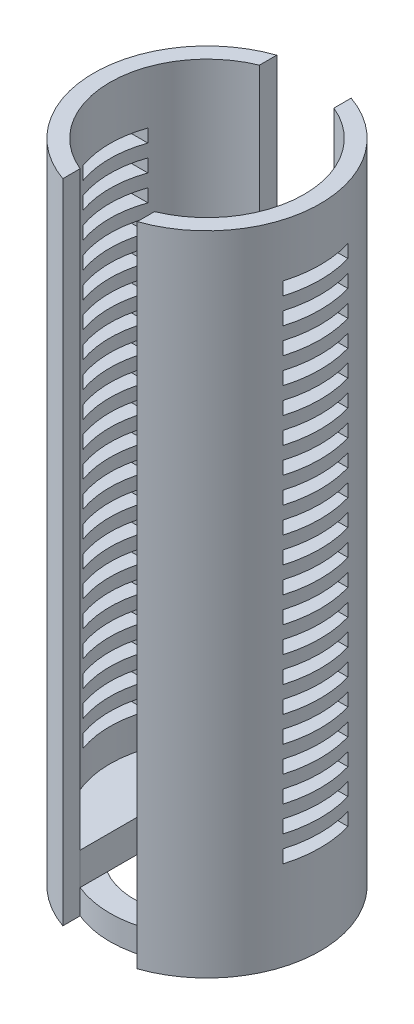
from build123d import *

# Parameters (mm, degrees)
BOSS_EXTRUDE1_DEPTH   = 5
BOSS_EXTRUDE1_2_DEPTH = 5
SKETCH1_4_R           = 1.25
CUT_EXTRUDE7_DEPTH    = 10
BOSS_EXTRUDE5_START   = 3.8
SKETCH12_R            = 15
SKETCH12_R_2          = 11.25
BOSS_EXTRUDE5_DEPTH   = 3.8
BOSS_EXTRUDE6_START   = -100
BOSS_EXTRUDE6_DEPTH   = 100
SKETCH14_W            = 10.01
SKETCH14_H            = 2.01
CUT_EXTRUDE8_DEPTH    = 104.694876923
LPATTERN1_COUNT       = 20
LPATTERN1_PITCH       = 4


# Read off the part's stored shape, not the designer's step: Boss-Extrude6
with BuildPart() as part:
    # Sketch1 → Boss-Extrude1 (new body)
    with BuildSketch(Plane(origin=(0, 0, 0), x_dir=(1, 0, 0), z_dir=(0, 1, 0))):
        with BuildLine():
            Line((-5.75, 13.854151002), (-5.75, -13.854151002))
            ThreePointArc((-5.75, -13.854151002), (-15, 0), (-5.75, 13.854151002))
        make_face()
    extrude(amount=BOSS_EXTRUDE1_DEPTH)


with BuildPart() as body_2:
    # Sketch1 → Boss-Extrude1 2 (new body)
    with BuildSketch(Plane(origin=(0, 0, 0), x_dir=(1, 0, 0), z_dir=(0, 1, 0))):
        with BuildLine():
            Line((5.75, 13.854151002), (5.75, -13.854151002))
            ThreePointArc((5.75, -13.854151002), (15, 0), (5.75, 13.854151002))
        make_face()
    extrude(amount=BOSS_EXTRUDE1_2_DEPTH)


with BuildPart() as cut_extrude7_tool:
    # Sketch1<4> → Cut-Extrude7 (new body)
    with BuildSketch(Plane(origin=(0, 0, 0), x_dir=(1, 0, 0), z_dir=(0, 1, 0))):
        with Locations(Location((-8, 0, 0), (0, 0, 270))):
            Circle(SKETCH1_4_R)
        with Locations(Location((8, 0, 0), (0, 0, 270))):
            Circle(SKETCH1_4_R)
    extrude(amount=CUT_EXTRUDE7_DEPTH)


with BuildPart() as part_1:
    add(part.part)

    # Cut-Extrude7: cut by cut_extrude7_tool
    add(cut_extrude7_tool.part, mode=Mode.SUBTRACT)



with BuildPart() as body_2_1:
    add(body_2.part)

    # Cut-Extrude7: cut by cut_extrude7_tool
    add(cut_extrude7_tool.part, mode=Mode.SUBTRACT)


with BuildPart() as part_2:
    add(part_1.part)

    add(body_2_1.part)  # Boss-Extrude5 merges body 2
    # Sketch12 → Boss-Extrude5 (add)
    with BuildSketch(Plane.XZ.offset(BOSS_EXTRUDE5_START)):
        with Locations(Location((0, 0, 0), (0, 0, 270))):
            Circle(SKETCH12_R)
        with Locations(Location((0, 0, 0), (0, 0, 59.262131328))):
            Circle(SKETCH12_R_2, mode=Mode.SUBTRACT)
    extrude(amount=-BOSS_EXTRUDE5_DEPTH)


with BuildPart() as body_2_2:
    # Boss-Extrude6 outline → Boss-Extrude6 (new body)
    with BuildSketch(Plane.XZ.offset(3.8).offset(BOSS_EXTRUDE6_START)):
        with BuildLine():
            ThreePointArc((5.75, 13.859564387), (15.005, 0), (5.75, -13.859564387))
            Line((5.75, -13.859564387), (5.75, -16.528384676))
            ThreePointArc((5.75, -16.528384676), (17.5, 0), (5.75, 16.528384676))
            Line((5.75, 16.528384676), (5.75, 13.859564387))
        make_face()
        with BuildLine():
            ThreePointArc((-5.75, -13.859564387), (-15.005, 0), (-5.75, 13.859564387))
            Line((-5.75, 13.859564387), (-5.75, 16.528384676))
            ThreePointArc((-5.75, 16.528384676), (-17.5, 0), (-5.75, -16.528384676))
            Line((-5.75, -16.528384676), (-5.75, -13.859564387))
        make_face()
    extrude(amount=BOSS_EXTRUDE6_DEPTH)

    # Sketch14 → Cut-Extrude8 (cut, through all)
    with BuildSketch(Plane(origin=(17.5, 0, 0), x_dir=(0, 0, -1), z_dir=(1, 0, 0))):
        with Locations((0, 11.005)):
            Rectangle(SKETCH14_W, SKETCH14_H)
    cut_extrude8 = extrude(amount=-CUT_EXTRUDE8_DEPTH, mode=Mode.SUBTRACT)

    # LPattern1: Cut-Extrude8 ×20
    with Locations(*[(0, i * LPATTERN1_PITCH, 0) for i in range(1, LPATTERN1_COUNT)]):
        add(cut_extrude8, mode=Mode.SUBTRACT)


solid = Compound([part_2.part, body_2_2.part])
